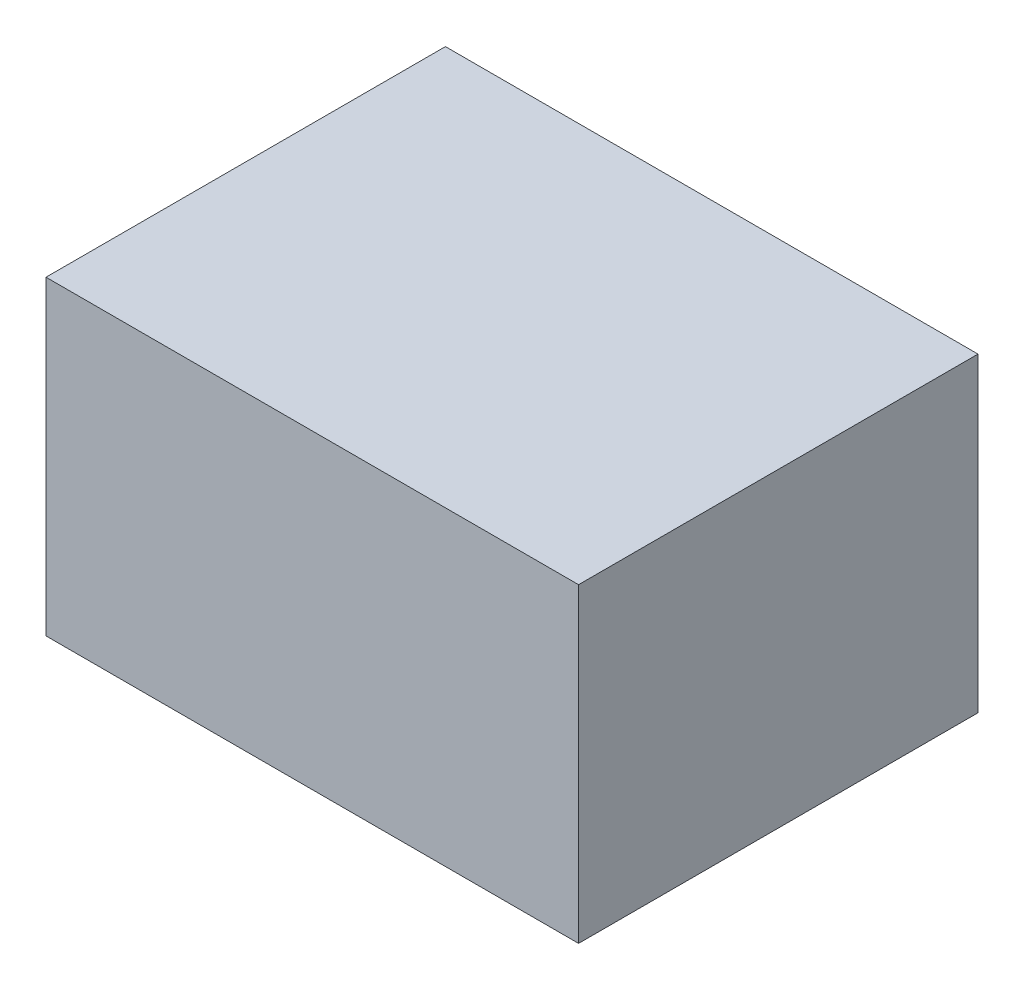
from build123d import *

# Parameters (mm, degrees)
SKETCH1_W           = 304.8
SKETCH1_H           = 228.6
BOSS_EXTRUDE1_DEPTH = 177.8


with BuildPart() as part:
    # Sketch1 → Boss-Extrude1 (new body)
    with BuildSketch(Plane(origin=(0, 0, 0), x_dir=(1, 0, 0), z_dir=(0, 1, 0))):
        Rectangle(SKETCH1_W, SKETCH1_H)
    extrude(amount=BOSS_EXTRUDE1_DEPTH)


solid = part.part
